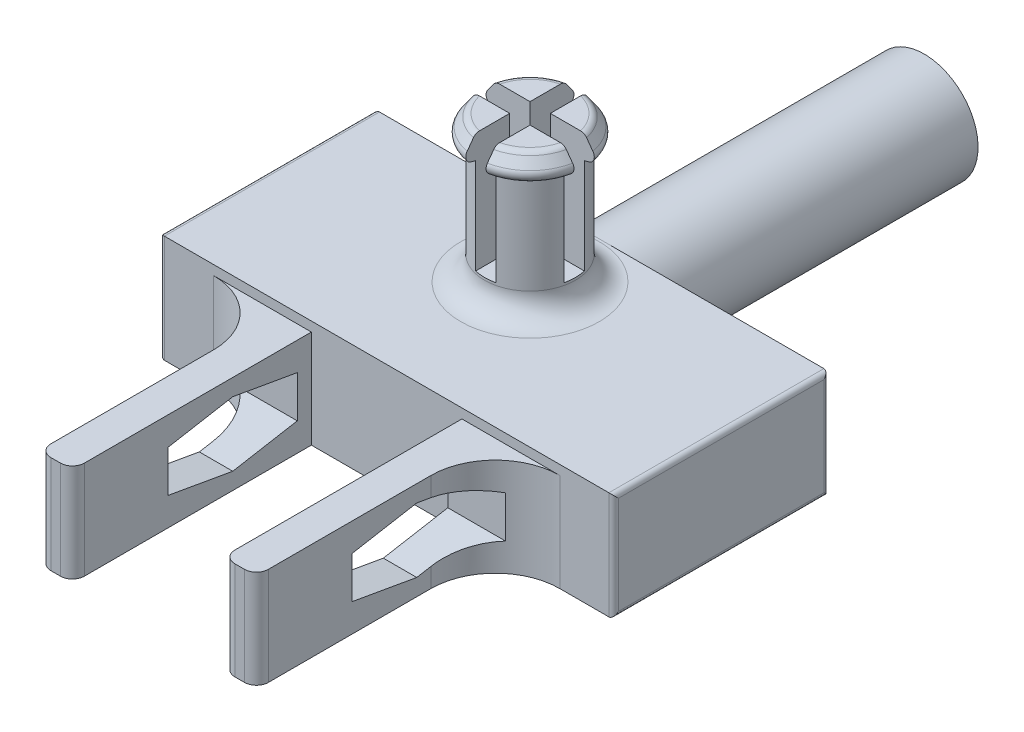
from build123d import *

# Parameters (mm, degrees)
DODANIE_WYCI_GNI_CIE1_DEPTH     = 4.5
DODANIE_WYCI_GNI_CIE2_DEPTH     = 4.1
SZKIC2_R                        = 2.25
DODANIE_WYCI_GNI_CIE3_DEPTH     = 13.5
WYTNIJ_WYCI_GNI_CIE2_DEPTH      = 23.456012558
WYTNIJ_WYCI_GNI_CIE2_DEPTH_BACK = 23.456012558
ZAOKR_GLENIE1_R                 = 0.5
ZAOKR_GLENIE2_R                 = 0.2
SZKIC4_R                        = 1.9
DODANIE_WYCI_GNI_CIE4_DEPTH     = 5.1
SZKIC5_R                        = 1.9
DODANIE_WYCI_GNI_CIE5_DEPTH     = 1
ZAOKR_GLENIE4_R                 = 1
ZAOKR_GLENIE6_R                 = 0.3
WYTNIJ_WYCI_GNI_CIE3_DEPTH      = 5


with BuildPart() as part:
    # Szkic1 → Dodanie-wyciągnięcie1 (new body)
    with BuildSketch(Plane(origin=(0, 0, 0), x_dir=(1, 0, 0), z_dir=(0, 1, 0))):
        Polygon((3.15, -4.5), (4.55, -4.5), (7.25, -4.5), (9.5, -4.5), (9.5, 4.5), (2.579268293, 4.5), (-2.579268293, 4.5), (-9.5, 4.5), (-9.5, -4.5), (-7.25, -4.5), (-4.55, -4.5), (-3.15, -4.5), align=None)
    extrude(amount=DODANIE_WYCI_GNI_CIE1_DEPTH)

    # Szkic1<7> → Dodanie-wyciągnięcie2 (add)
    with BuildSketch(Plane(origin=(0, 0, 0), x_dir=(1, 0, 0), z_dir=(0, 1, 0))):
        with BuildLine():
            Line((4.55, -14.5), (4.55, -7.2))
            ThreePointArc((4.55, -7.2), (5.340811691, -5.290811691), (7.25, -4.5))
            Line((7.25, -4.5), (3.15, -4.5))
            Line((3.15, -4.5), (3.15, -14.5))
            Line((3.15, -14.5), (4.55, -14.5))
        make_face()
        with BuildLine():
            Line((-3.15, -14.5), (-3.15, -4.5))
            Line((-3.15, -4.5), (-7.25, -4.5))
            ThreePointArc((-7.25, -4.5), (-5.340811691, -5.290811691), (-4.55, -7.2))
            Line((-4.55, -7.2), (-4.55, -14.5))
            Line((-4.55, -14.5), (-3.15, -14.5))
        make_face()
    extrude(amount=DODANIE_WYCI_GNI_CIE2_DEPTH)

    # Szkic2 → Dodanie-wyciągnięcie3 (add)
    with BuildSketch(Plane(origin=(0, 0, -4.5), x_dir=(-1, 0, 0), z_dir=(0, 0, -1))):
        with Locations((0, 2.25)):
            Circle(SZKIC2_R)
    extrude(amount=DODANIE_WYCI_GNI_CIE3_DEPTH)

    # Szkic3 → Wytnij-wyciągnięcie2 (cut, two sides: drawn at the far end of the back side and taken through both)
    with BuildSketch(Plane(origin=(-3.15, 0, 0), x_dir=(0, 0, -1), z_dir=(1, 0, 0)).offset(-WYTNIJ_WYCI_GNI_CIE2_DEPTH_BACK)):
        Polygon((-7.790001582, 3.4), (-10.490001582, 2.923917152), (-10.490001582, 1.176082848), (-7.790001582, 0.7), (-5.090001582, 1.176082848), (-5.090001582, 2.923917152), align=None)
    extrude(amount=WYTNIJ_WYCI_GNI_CIE2_DEPTH + WYTNIJ_WYCI_GNI_CIE2_DEPTH_BACK, mode=Mode.SUBTRACT)

    # Zaokrąglenie1
    zaokr_glenie1_edges = [part.edges().sort_by_distance(p)[0] for p in [
        (3.15, 2.05, 14.5),
        (4.55, 2.05, 14.5),
        (-4.55, 2.05, 14.5),
        (-3.15, 2.05, 14.5),
    ]]
    fillet(zaokr_glenie1_edges, radius=ZAOKR_GLENIE1_R)

    # Zaokrąglenie2
    zaokr_glenie2_edges = [part.edges().sort_by_distance(p)[0] for p in [
        (-9.5, 2.25, -4.5),
        (-9.5, 4.5, 0),
        (9.5, 0, 0),
        (-9.5, 2.25, 4.5),
        (9.5, 2.25, 4.5),
        (9.5, 2.25, -4.5),
        (9.5, 4.5, 0),
        (-9.5, 0, 0),
    ]]
    fillet(zaokr_glenie2_edges, radius=ZAOKR_GLENIE2_R)

    # Szkic4 → Dodanie-wyciągnięcie4 (add)
    with BuildSketch(Plane(origin=(0, 4.5, 0), x_dir=(1, 0, 0), z_dir=(0, 1, 0))):
        with Locations((0, 1.5)):
            Circle(SZKIC4_R)
    extrude(amount=DODANIE_WYCI_GNI_CIE4_DEPTH)

    # Szkic5 → Dodanie-wyciągnięcie5 (add)
    with BuildSketch(Plane(origin=(0, 9.6, 0), x_dir=(1, 0, 0), z_dir=(0, 1, 0))):
        with Locations((0, 1.5)):
            Circle(SZKIC5_R)
    extrude(amount=DODANIE_WYCI_GNI_CIE5_DEPTH)

    # Zaokrąglenie4
    zaokr_glenie4_edges = [part.edges().sort_by_distance(p)[0] for p in [
        (-1.9, 4.5, -1.5),
    ]]
    fillet(zaokr_glenie4_edges, radius=ZAOKR_GLENIE4_R)

    # Szkic7 → Obrót1 (revolve)
    with BuildSketch(Plane(origin=(0, 0, 0), x_dir=(0, 0, -1), z_dir=(1, 0, 0))):
        Polygon((3.4, 10.6), (3.4, 9.6), (4, 9.760769515), align=None)
    revolve(axis=Axis((0, 9.6, -1.5), (0, -1, 0)))

    # Zaokrąglenie6
    zaokr_glenie6_edges = [part.edges().sort_by_distance(p)[0] for p in [
        (0, 9.760769515, 1),
        (0, 10.6, 0.4),
    ]]
    fillet(zaokr_glenie6_edges, radius=ZAOKR_GLENIE6_R)

    # Szkic6 → Wytnij-wyciągnięcie3 (cut)
    with BuildSketch(Plane(origin=(0, 10.6, 0), x_dir=(1, 0, 0), z_dir=(0, 1, 0))):
        with BuildLine():
            Line((0.425, 4.714465969), (0.425, 1.925))
            Line((0.425, 1.925), (3.214465969, 1.925))
            ThreePointArc((3.214465969, 1.925), (3.242439894, 1.5), (3.214465969, 1.075))
            Line((3.214465969, 1.075), (0.425, 1.075))
            Line((0.425, 1.075), (0.425, -1.714465969))
            ThreePointArc((0.425, -1.714465969), (0, -1.742439894), (-0.425, -1.714465969))
            Line((-0.425, -1.714465969), (-0.425, 1.075))
            Line((-0.425, 1.075), (-3.214465969, 1.075))
            ThreePointArc((-3.214465969, 1.075), (-3.242439894, 1.5), (-3.214465969, 1.925))
            Line((-3.214465969, 1.925), (-0.425, 1.925))
            Line((-0.425, 1.925), (-0.425, 4.714465969))
            ThreePointArc((-0.425, 4.714465969), (0, 4.742439894), (0.425, 4.714465969))
        make_face()
    extrude(amount=-WYTNIJ_WYCI_GNI_CIE3_DEPTH, mode=Mode.SUBTRACT)


solid = part.part
